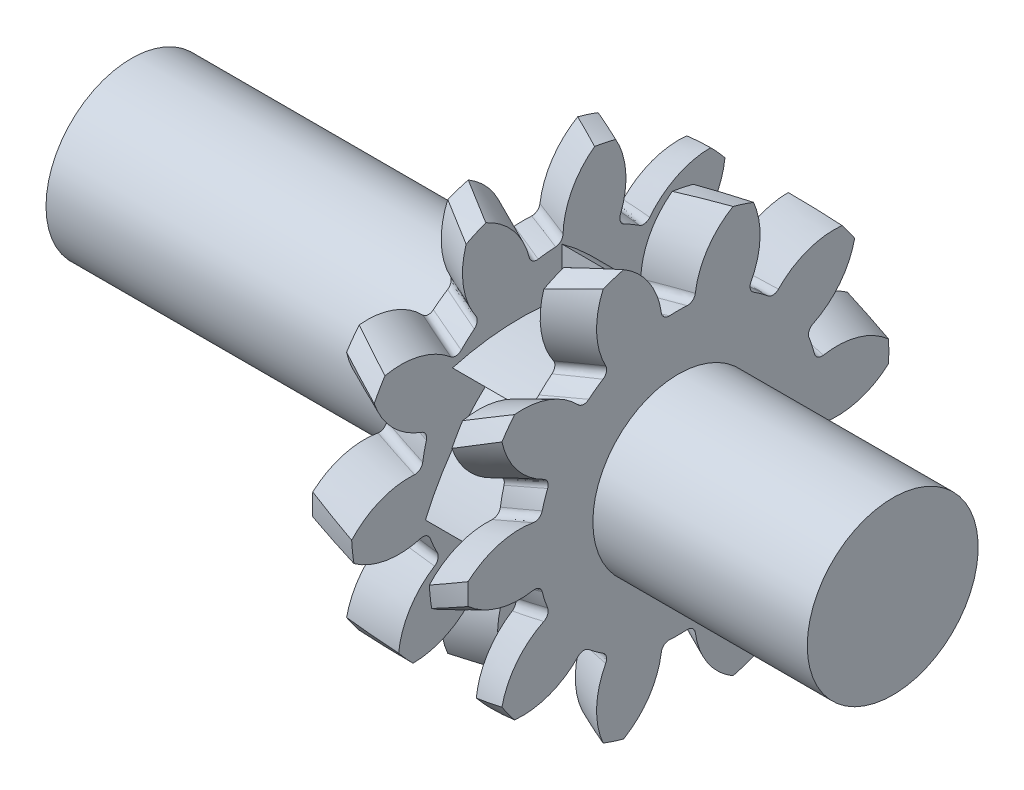
from build123d import *

# Parameters (mm, degrees)
BASPROSKE_W             = 5
BASPROSKE_H             = 13.547005384
TOOTHCUTRH_PITCH        = 147.429298514
TOOTHCUTRH_HEIGHT       = 5
TOOTHCUTRH_RADIUS       = 13.547005384
TOOTHCUTRH_START_ANGLE  = -90
TEETHCUTSRH_COUNT       = 10
TEETHCUTSRH_ANGLE       = 324
BORSKE_R                = 5.5
BORE_DEPTH              = 62.5000025
BOSS_EXTRU_1_DEPTH      = 25.2
BOSS_EXTRU_1_DEPTH_BACK = 23.8
ESQUISSE1_R             = 5.5
ESQUISSE3_R             = 13.547005384
ESQUISSE3_R_2           = 5.5
ENL_V_MAT_EXTRU_3_DEPTH = 2.5
BOSS_EXTRU_2_DEPTH      = 2.5


with BuildPart() as part:
    # BasProSke → Base-Revolve (revolve)
    with BuildSketch(Plane(origin=(0, 0, 0), x_dir=(1, 0, 0), z_dir=(0, 1, 0)), mode=Mode.PRIVATE) as base_revolve_sk:
        with Locations((2.5, 6.773502692)):
            Rectangle(BASPROSKE_W, BASPROSKE_H)
    revolve(base_revolve_sk.sketch.rotate(Axis((-10, 0, 0), (1, 0, 0)), 180), axis=Axis((-10, 0, 0), (1, 0, 0)))

    # ToothCutRH: sweep along a helix
    with BuildLine() as toothcutrh_path:
        add(Helix(TOOTHCUTRH_PITCH, TOOTHCUTRH_HEIGHT, TOOTHCUTRH_RADIUS, center=(0, 0, 0), direction=(1, 0, 0), mode=Mode.PRIVATE).rotate(Axis((0, 0, 0), (1, 0, 0)), TOOTHCUTRH_START_ANGLE))
    # TooCutSkeRH → ToothCutRH (sweep, cut)
    with BuildSketch(Plane(origin=(0, 0, 0), x_dir=(0, 0, -1), z_dir=(1, 0, 0))):
        with BuildLine():
            ThreePointArc((0.56474538, 9.029361498), (0, 9.047005384), (-0.56474538, 9.029361498))
            ThreePointArc((-0.56474538, 9.029361498), (-0.912719018, 9.141180308), (-1.092137157, 9.459611196))
            ThreePointArc((-1.092137157, 9.459611196), (-2.065450401, 11.792434954), (-4.055435717, 13.351076606))
            ThreePointArc((-4.055435717, 13.351076606), (0, 13.953415545), (4.055435717, 13.351076606))
            ThreePointArc((4.055435717, 13.351076606), (2.065450401, 11.792434954), (1.092137157, 9.459611196))
            ThreePointArc((1.092137157, 9.459611196), (0.912719018, 9.141180308), (0.56474538, 9.029361498))
        make_face()
    toothcutrh = sweep(path=toothcutrh_path.line, is_frenet=True, mode=Mode.SUBTRACT)

    # TeethCutsRH: ToothCutRH ×10 about axis
    teethcutsrh_axis = Axis((-10, 0, 0), (1, 0, 0))
    for i in range(1, TEETHCUTSRH_COUNT):
        add(toothcutrh.rotate(teethcutsrh_axis, i * TEETHCUTSRH_ANGLE / (TEETHCUTSRH_COUNT - 1)), mode=Mode.SUBTRACT)

    # BorSke → Bore (cut, symmetric)
    with BuildSketch(Plane(origin=(0, 0, 0), x_dir=(0, 0, -1), z_dir=(1, 0, 0))):
        with Locations(Location((0, 0, 0), (0, 0, 180))):
            Circle(BORSKE_R)
    extrude(amount=BORE_DEPTH, both=True, mode=Mode.SUBTRACT)

    # Symétrie1: part across plane


with BuildPart() as part_1:
    add(part.part)
    add(part.part.mirror(Plane.ZY.offset(-5)))

    # Esquisse3 → Enlèv. mat.-Extru.3 (cut, symmetric)
    with BuildSketch(Plane(origin=(5, 0, 0), x_dir=(0, 0, -1), z_dir=(1, 0, 0))):
        Circle(ESQUISSE3_R)
        with Locations(Location((0, 0, 0), (0, 0, 180))):
            Circle(ESQUISSE3_R_2, mode=Mode.SUBTRACT)
    extrude(amount=ENL_V_MAT_EXTRU_3_DEPTH, both=True, mode=Mode.SUBTRACT)


with BuildPart() as body_2:
    # Esquisse1 → Boss.-Extru.1 (new, two sides: drawn at the far end of the back side and taken through both)
    with BuildSketch(Plane.ZY.offset(-BOSS_EXTRU_1_DEPTH_BACK)):
        Circle(ESQUISSE1_R)
    extrude(amount=BOSS_EXTRU_1_DEPTH + BOSS_EXTRU_1_DEPTH_BACK)



with BuildPart() as enl_v_mat_extru_3_piece_1:
    # of the separate pieces the step leaves, piece 1, a body of its own (enl_v_mat_extru_3_pieces)
    add(part_1.part.solids().sort_by_distance((7.5, 13.096034275, -3.466300785))[0])


with BuildPart() as enl_v_mat_extru_3_piece_2:
    # of the separate pieces the step leaves, piece 2, a body of its own (enl_v_mat_extru_3_pieces)
    add(part_1.part.solids().sort_by_distance((0, 9.459611196, -1.092137157))[0])


with BuildPart() as body_2_1:
    add(body_2.part)

    add(enl_v_mat_extru_3_piece_1.part)  # Boss.-Extru.2 merges Enlèv. mat.-Extru.3 piece 1

    add(enl_v_mat_extru_3_piece_2.part)  # Boss.-Extru.2 merges Enlèv. mat.-Extru.3 piece 2
    # Esquisse4 → Boss.-Extru.2 (add, symmetric)
    with BuildSketch(Plane(origin=(5, 0, 0), x_dir=(0, 0, -1), z_dir=(1, 0, 0))):
        with BuildLine():
            Line((0, 9), (0, 6))
            add(Edge.make_bspline(
                [(-7.036483342, 5.611408217), (-3.587913691, 6.561465668), (0, 6)],
                knots=[0, 0, 0, 1, 1, 1], degree=2))
            Line((-7.036483342, 5.611408217), (-4.690988895, 3.740938811))
            add(Edge.make_bspline(
                [(-8.77435121, -2.002688406), (-7.366988027, 1.285863049), (-4.690988895, 3.740938811)],
                knots=[0, 0, 0, 1, 1, 1], degree=2))
            Line((-8.77435121, -2.002688406), (-5.849567473, -1.335125604))
            add(Edge.make_bspline(
                [(-3.904953652, -8.108719811), (-5.598570119, -4.958020672), (-5.849567473, -1.335125604)],
                knots=[0, 0, 0, 1, 1, 1], degree=2))
            Line((-3.904953652, -8.108719811), (-2.603302435, -5.405813207))
            add(Edge.make_bspline(
                [(3.904953652, -8.108719811), (0.385685278, -7.468413702), (-2.603302435, -5.405813207)],
                knots=[0, 0, 0, 1, 1, 1], degree=2))
            Line((3.904953652, -8.108719811), (2.603302435, -5.405813207))
            add(Edge.make_bspline(
                [(8.77435121, -2.002688406), (6.079511794, -4.354938887), (2.603302435, -5.405813207)],
                knots=[0, 0, 0, 1, 1, 1], degree=2))
            Line((8.77435121, -2.002688406), (5.849567473, -1.335125604))
            add(Edge.make_bspline(
                [(7.036483342, 5.611408217), (7.19534193, 2.037893735), (5.849567473, -1.335125604)],
                knots=[0, 0, 0, 1, 1, 1], degree=2))
            Line((7.036483342, 5.611408217), (4.690988895, 3.740938811))
            add(Edge.make_bspline(
                [(0, 9), (2.892932834, 6.896150809), (4.690988895, 3.740938811)],
                knots=[0, 0, 0, 1, 1, 1], degree=2))
        make_face()
    extrude(amount=BOSS_EXTRU_2_DEPTH, both=True)


solid = body_2_1.part
